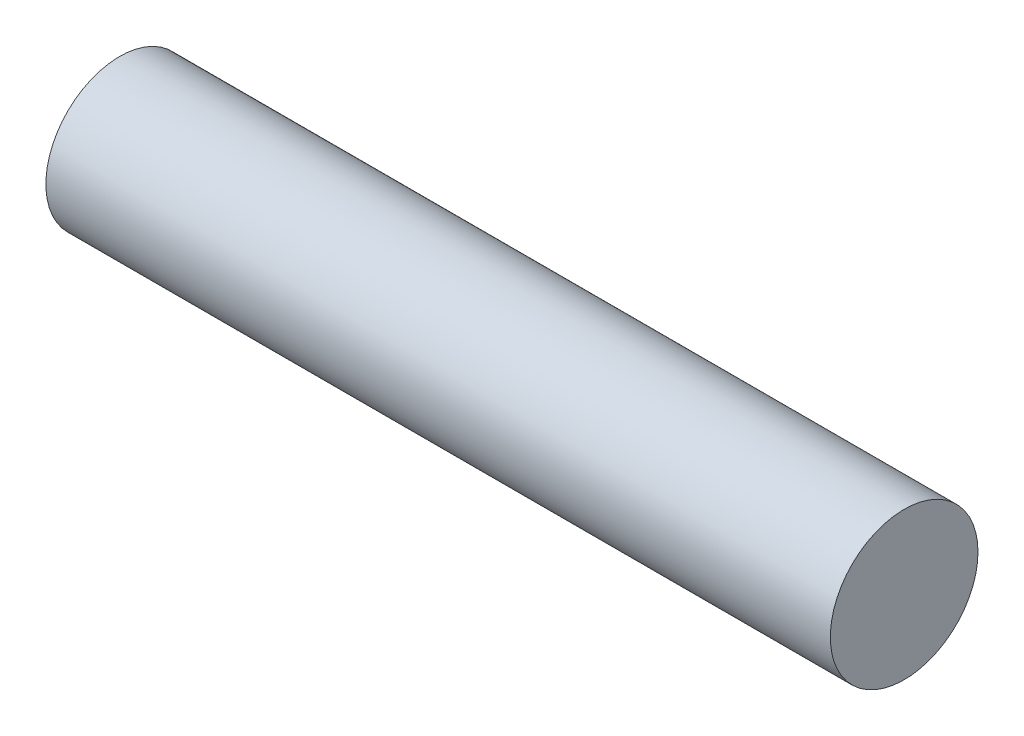
from build123d import *

# Parameters (mm, degrees)
SKETCH1_R          = 80
FOAMBODY_DEPTH     = 850
BATTERY_START      = 10
SKETCH2_W          = 165
SKETCH2_H          = 60
BATTERY_BAY_DEPTH  = 60
FOAM_START         = 10
SKETCH3_W          = 150
SKETCH3_H          = 80
FOAM_DEPTH         = 35
BATTERY_DEPTH      = 3
BATTERY_DEPTH_BACK = 47
SKETCH4_W          = 155
SKETCH4_H          = 48
FC_START           = 13
SKETCH5_W          = 52
SKETCH5_H          = 32
FC_DEPTH           = 17


with BuildPart() as part:
    # Sketch1 → FoamBody (new body)
    with BuildSketch(Plane(origin=(0, 0, 0), x_dir=(0, 0, -1), z_dir=(1, 0, 0))):
        Circle(SKETCH1_R)
    extrude(amount=-FOAMBODY_DEPTH)

    # Sketch2 → battery bay (cut)
    with BuildSketch(Plane(origin=(0, 0, 0), x_dir=(1, 0, 0), z_dir=(0, 1, 0)).offset(BATTERY_START)):
        with Locations((-261, 0)):
            Rectangle(SKETCH2_W, SKETCH2_H)
    extrude(amount=-BATTERY_BAY_DEPTH, mode=Mode.SUBTRACT)

    # Sketch3 → Foam (cut)
    with BuildSketch(Plane(origin=(0, 0, 0), x_dir=(1, 0, 0), z_dir=(0, 1, 0)).offset(FOAM_START)):
        with Locations((-225, 0)):
            Rectangle(SKETCH3_W, SKETCH3_H)
    extrude(amount=FOAM_DEPTH, mode=Mode.SUBTRACT)


with BuildPart() as body_2:
    # Sketch4 → Battery (new, two sides: drawn at the far end of the back side and taken through both)
    with BuildSketch(Plane(origin=(0, 0, 0), x_dir=(1, 0, 0), z_dir=(0, 1, 0)).offset(-BATTERY_DEPTH_BACK)):
        with Locations((-261, 0)):
            Rectangle(SKETCH4_W, SKETCH4_H)
    extrude(amount=BATTERY_DEPTH + BATTERY_DEPTH_BACK)


with BuildPart() as body_3:
    # Sketch5 → FC (new body)
    with BuildSketch(Plane(origin=(0, 0, 0), x_dir=(1, 0, 0), z_dir=(0, 1, 0)).offset(FC_START)):
        with Locations((-225, 0)):
            Rectangle(SKETCH5_W, SKETCH5_H)
    extrude(amount=FC_DEPTH)


solid = Compound([part.part, body_2.part, body_3.part])
